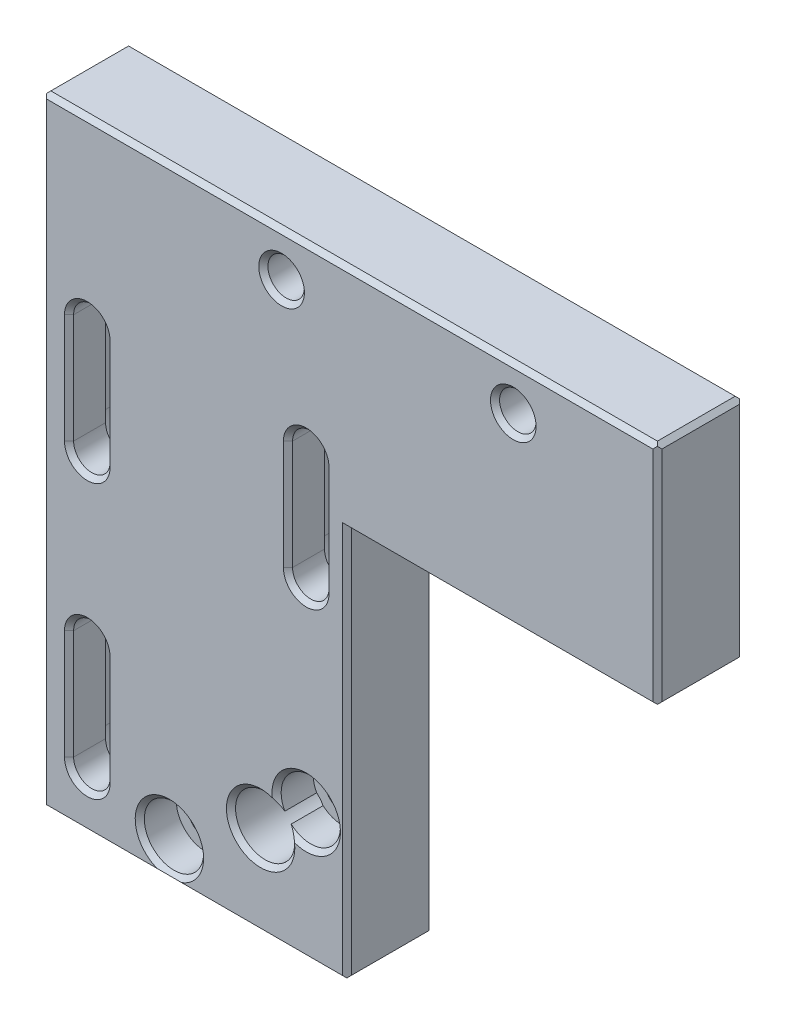
from build123d import *

# Parameters (mm, degrees)
SKETCH1_R           = 3.25
SKETCH1_R_2         = 2
BOSS_EXTRUDE1_DEPTH = 9.525
SKETCH1_4_R         = 2
SKETCH1_4_R_2       = 3.25
BOSS_EXTRUDE3_DEPTH = 5.525
CUT_EXTRUDE1_DEPTH  = 91.205186242
CUT_EXTRUDE2_DEPTH  = 5.525
CHAMFER1_SIZE       = 0.5
CHAMFER2_SIZE       = 0.5
CHAMFER3_SIZE       = 0.5
CHAMFER4_SIZE       = 0.5
SKETCH5_R           = 3.25
CUT_EXTRUDE3_DEPTH  = 5.525
CHAMFER5_SIZE       = 0.5


with BuildPart() as part:
    # Sketch1 → Boss-Extrude1 (new body)
    with BuildSketch(Plane.XY):
        Polygon((-9, 0), (0, 0), (24.45, 0), (24.45, 43), (58.5, 43), (58.5, 68), (0, 68), (-9, 68), align=None)
        with Locations(Location((5, 4, 0), (0, 0, 180))):
            Circle(SKETCH1_R, mode=Mode.SUBTRACT)
        with BuildLine():
            ThreePointArc((17.849215148, 11.563481065), (18.148209748, 10.807016347), (18.25, 10))
            ThreePointArc((18.25, 10), (12.037522087, 8.663502856), (17.150784852, 12.436518935))
            ThreePointArc((17.150784852, 12.436518935), (19.192983653, 17.148209748), (23.25, 14))
            ThreePointArc((23.25, 14), (21.336497144, 11.037522087), (17.849215148, 11.563481065))
        make_face(mode=Mode.SUBTRACT)
        with Locations(Location((17.3, 63.2375, 0), (0, 0, 180))):
            Circle(SKETCH1_R_2, mode=Mode.SUBTRACT)
        with Locations(Location((42.7, 63.2375, 0), (0, 0, 180))):
            Circle(SKETCH1_R_2, mode=Mode.SUBTRACT)
    extrude(amount=BOSS_EXTRUDE1_DEPTH)

    # Sketch1<4> → Boss-Extrude3 (add)
    # profile 1 of 2: a face of its own
    with BuildSketch(Plane.XY):
        with BuildLine():
            ThreePointArc((17.150784852, 12.436518935), (17.537823631, 12.030258905), (17.849215148, 11.563481065))
            ThreePointArc((17.849215148, 11.563481065), (22.537823631, 16.030258905), (17.150784852, 12.436518935))
        make_face()
        with Locations((20, 14)):
            Circle(SKETCH1_4_R, mode=Mode.SUBTRACT)
    # profile 2 of 2: a face of its own
    with BuildSketch(Plane.XY):
        with Locations(Location((5, 4, 0), (0, 0, 180))):
            Circle(SKETCH1_4_R_2)
        with Locations((5, 4)):
            Circle(SKETCH1_4_R, mode=Mode.SUBTRACT)
    extrude(amount=BOSS_EXTRUDE3_DEPTH)

    # Sketch3 → Cut-Extrude1 (cut, through all)
    with BuildSketch(Plane.XY.offset(9.525)):
        with BuildLine():
            Line((-2, 18), (-2, 6))
            ThreePointArc((-2, 6), (-4, 4), (-6, 6))
            Line((-6, 6), (-6, 18))
            ThreePointArc((-6, 18), (-4, 20), (-2, 18))
        make_face()
        with BuildLine():
            Line((-6, 48), (-6, 36))
            ThreePointArc((-6, 36), (-4, 34), (-2, 36))
            Line((-2, 36), (-2, 48))
            ThreePointArc((-2, 48), (-4, 50), (-6, 48))
        make_face()
        with BuildLine():
            Line((18, 48), (18, 36))
            ThreePointArc((18, 36), (20, 34), (22, 36))
            Line((22, 36), (22, 48))
            ThreePointArc((22, 48), (20, 50), (18, 48))
        make_face()
    extrude(amount=-CUT_EXTRUDE1_DEPTH, mode=Mode.SUBTRACT)

    # Sketch4 → Cut-Extrude2 (cut)
    with BuildSketch(Plane(origin=(0, 0, 0), x_dir=(-1, 0, 0), z_dir=(0, 0, -1))):
        with BuildLine():
            Line((-16.75, 36), (-16.75, 48))
            ThreePointArc((-16.75, 48), (-20, 51.25), (-23.25, 48))
            Line((-23.25, 48), (-23.25, 36))
            ThreePointArc((-23.25, 36), (-20, 32.75), (-16.75, 36))
        make_face()
        with BuildLine():
            Line((0.75, 48), (0.75, 36))
            ThreePointArc((0.75, 36), (4, 32.75), (7.25, 36))
            Line((7.25, 36), (7.25, 48))
            ThreePointArc((7.25, 48), (4, 51.25), (0.75, 48))
        make_face()
        with BuildLine():
            Line((7.25, 6), (7.25, 18))
            ThreePointArc((7.25, 18), (3.997663937, 21.24999916), (0.75, 17.99532787))
            Line((0.75, 17.99532787), (0.75, 5.99532787))
            ThreePointArc((0.75, 5.99532787), (4.002336066, 2.749997481), (7.25, 6))
        make_face()
    extrude(amount=-CUT_EXTRUDE2_DEPTH, mode=Mode.SUBTRACT)

    # Chamfer1
    chamfer1_edges = [part.edges().sort_by_distance(p)[0] for p in [
        (-9, 68, 4.7625),
    ]]
    chamfer(chamfer1_edges, length=CHAMFER1_SIZE)

    # Chamfer2
    chamfer2_edges = [part.edges().sort_by_distance(p)[0] for p in [
        (58.5, 68, 4.7625),
        (58.5, 43, 4.7625),
        (24.45, 0, 4.7625),
        (-9, 0, 4.7625),
    ]]
    chamfer(chamfer2_edges, length=CHAMFER2_SIZE)

    # Chamfer3
    # the kernel refuses this chamfer: 0.5 mm, written as the material it takes off along each edge
    with BuildSketch(Plane(origin=(59.285841494, 68, 0), x_dir=(0, -0.9996219169112968, -0.027495876610586483), z_dir=(-1, 0, 0)), Plane(origin=(-9.785841494, 68, 9.525), x_dir=(0, -0.9996219169112968, 0.02749587661058574), z_dir=(1, 0, 0))) as chamfer3_piece_1:
        Polygon((CHAMFER3_SIZE * 0.999621916911, CHAMFER3_SIZE * 0.0274958766106), (-CHAMFER3_SIZE * 0.0274958766106, CHAMFER3_SIZE * 0.999621916911), (0, 0), align=None)
    extrude(amount=69.071682988, mode=Mode.SUBTRACT)
    with BuildSketch(Plane(origin=(58.5, 42.214158506, 0), x_dir=(-0.9996219169112968, 0, -0.027495876610586483), z_dir=(0, 1, 0))) as chamfer3_piece_2:
        Polygon((CHAMFER3_SIZE * 0.999621916911, CHAMFER3_SIZE * 0.0274958766106), (-CHAMFER3_SIZE * 0.0274958766106, CHAMFER3_SIZE * 0.999621916911), (0, 0), align=None)
    extrude(amount=26.571682988, mode=Mode.SUBTRACT)
    with BuildSketch(Plane(origin=(24.45, 43, 0), x_dir=(0, 0.9996219169112968, -0.027495876610586483), z_dir=(1, 0, 0))) as chamfer3_piece_3:
        Polygon((CHAMFER3_SIZE * 0.999621916911, CHAMFER3_SIZE * 0.0274958766106), (-CHAMFER3_SIZE * 0.0274958766106, CHAMFER3_SIZE * 0.999621916911), (0, 0), align=None)
    extrude(amount=34.835841494, mode=Mode.SUBTRACT)
    with BuildSketch(Plane(origin=(24.45, -0.785841494, 0), x_dir=(-0.9996219169112968, 0, -0.027495876610586292), z_dir=(0, 1, 0))) as chamfer3_piece_4:
        Polygon((CHAMFER3_SIZE * 0.999621916911, CHAMFER3_SIZE * 0.0274958766106), (-CHAMFER3_SIZE * 0.0274958766106, CHAMFER3_SIZE * 0.999621916911), (0, 0), align=None)
    extrude(amount=43.785841494, mode=Mode.SUBTRACT)
    with BuildSketch(Plane(origin=(58.5, 42.214158506, 9.525), x_dir=(-0.9996219169112968, 0, 0.02749587661058574), z_dir=(0, 1, 0))) as chamfer3_piece_5:
        Polygon((CHAMFER3_SIZE * 0.999621916911, -CHAMFER3_SIZE * 0.0274958766106), (-CHAMFER3_SIZE * 0.0274958766106, -CHAMFER3_SIZE * 0.999621916911), (0, 0), align=None)
    extrude(amount=26.571682988, mode=Mode.SUBTRACT)
    with BuildSketch(Plane(origin=(24.45, 43, 9.525), x_dir=(0, 0.9996219169112968, 0.02749587661058574), z_dir=(1, 0, 0))) as chamfer3_piece_6:
        Polygon((CHAMFER3_SIZE * 0.999621916911, -CHAMFER3_SIZE * 0.0274958766106), (-CHAMFER3_SIZE * 0.0274958766106, -CHAMFER3_SIZE * 0.999621916911), (0, 0), align=None)
    extrude(amount=34.835841494, mode=Mode.SUBTRACT)
    with BuildSketch(Plane(origin=(24.45, -0.785841494, 9.525), x_dir=(-0.9996219169112968, 0, 0.02749587661058555), z_dir=(0, 1, 0))) as chamfer3_piece_7:
        Polygon((CHAMFER3_SIZE * 0.999621916911, -CHAMFER3_SIZE * 0.0274958766106), (-CHAMFER3_SIZE * 0.0274958766106, -CHAMFER3_SIZE * 0.999621916911), (0, 0), align=None)
    extrude(amount=43.785841494, mode=Mode.SUBTRACT)
    with BuildSketch(Plane(origin=(-9.785841494, 0, 0), x_dir=(0, 0.9996219169112968, -0.027495876610586334), z_dir=(1, 0, 0)), Plane(origin=(25.235841494, 0, 9.525), x_dir=(0, 0.9996219169112968, 0.02749587661058563), z_dir=(-1, 0, 0))) as chamfer3_piece_8:
        Polygon((CHAMFER3_SIZE * 0.999621916911, CHAMFER3_SIZE * 0.0274958766106), (-CHAMFER3_SIZE * 0.0274958766106, CHAMFER3_SIZE * 0.999621916911), (0, 0), align=None)
    extrude(amount=35.021682988, mode=Mode.SUBTRACT)
    with BuildSketch(Plane(origin=(-9, 68.785841494, 0), x_dir=(-0.02749587661058563, 0, 0.9996219169112968), z_dir=(0, -1, 0))) as chamfer3_piece_9:
        Polygon((CHAMFER3_SIZE * 0.999621916911, -CHAMFER3_SIZE * 0.0274958766106), (-CHAMFER3_SIZE * 0.0274958766106, -CHAMFER3_SIZE * 0.999621916911), (0, 0), align=None)
    extrude(amount=69.571682988, mode=Mode.SUBTRACT)
    with BuildSketch(Plane(origin=(-9, 68.785841494, 9.525), x_dir=(-0.027495876610585647, 0, -0.9996219169112968), z_dir=(0, -1, 0))) as chamfer3_piece_10:
        Polygon((CHAMFER3_SIZE * 0.999621916911, CHAMFER3_SIZE * 0.0274958766106), (-CHAMFER3_SIZE * 0.0274958766106, CHAMFER3_SIZE * 0.999621916911), (0, 0), align=None)
    extrude(amount=69.571682988, mode=Mode.SUBTRACT)
    with BuildSketch(Plane(origin=(24.45, -0.785841494, 0), x_dir=(-0.9996219169112968, 0, -0.027495876610586292), z_dir=(0, 1, 0))) as chamfer3_piece_11a_section:
        Polygon((CHAMFER3_SIZE * 0.999621916911, CHAMFER3_SIZE * 0.0274958766106), (-CHAMFER3_SIZE * 0.0274958766106, CHAMFER3_SIZE * 0.999621916911), (0, 0), align=None)
    chamfer3_piece_11a = extrude(amount=45.071682988, mode=Mode.PRIVATE)
    chamfer3_piece_11a = split(chamfer3_piece_11a, bisect_by=Plane(origin=(24.285103187, 43, 0.164896813), z_dir=(0, 1, 0)), keep=Keep.TOP, mode=Mode.PRIVATE)
    with BuildSketch(Plane(origin=(23.164158506, 43, 0), x_dir=(0, 0.9996219169112968, -0.027495876610586483), z_dir=(1, 0, 0))) as chamfer3_piece_11b_section:
        Polygon((CHAMFER3_SIZE * 0.999621916911, CHAMFER3_SIZE * 0.0274958766106), (-CHAMFER3_SIZE * 0.0274958766106, CHAMFER3_SIZE * 0.999621916911), (0, 0), align=None)
    chamfer3_piece_11b = extrude(amount=36.121682988, mode=Mode.PRIVATE)
    chamfer3_piece_11b = split(chamfer3_piece_11b, bisect_by=Plane(origin=(24.45, 43.164896813, 0.164896813), z_dir=(-1, 0, 0)), keep=Keep.TOP, mode=Mode.PRIVATE)
    chamfer3_piece_11 = chamfer3_piece_11a & chamfer3_piece_11b
    add(chamfer3_piece_11, mode=Mode.SUBTRACT)
    with BuildSketch(Plane(origin=(24.45, -0.785841494, 9.525), x_dir=(-0.9996219169112968, 0, 0.02749587661058555), z_dir=(0, 1, 0))) as chamfer3_piece_12a_section:
        Polygon((CHAMFER3_SIZE * 0.999621916911, -CHAMFER3_SIZE * 0.0274958766106), (-CHAMFER3_SIZE * 0.0274958766106, -CHAMFER3_SIZE * 0.999621916911), (0, 0), align=None)
    chamfer3_piece_12a = extrude(amount=45.071682988, mode=Mode.PRIVATE)
    chamfer3_piece_12a = split(chamfer3_piece_12a, bisect_by=Plane(origin=(24.285103187, 43, 9.360103187), z_dir=(0, 1, 0)), keep=Keep.TOP, mode=Mode.PRIVATE)
    with BuildSketch(Plane(origin=(23.164158506, 43, 9.525), x_dir=(0, 0.9996219169112968, 0.02749587661058574), z_dir=(1, 0, 0))) as chamfer3_piece_12b_section:
        Polygon((CHAMFER3_SIZE * 0.999621916911, -CHAMFER3_SIZE * 0.0274958766106), (-CHAMFER3_SIZE * 0.0274958766106, -CHAMFER3_SIZE * 0.999621916911), (0, 0), align=None)
    chamfer3_piece_12b = extrude(amount=36.121682988, mode=Mode.PRIVATE)
    chamfer3_piece_12b = split(chamfer3_piece_12b, bisect_by=Plane(origin=(24.45, 43.164896813, 9.360103187), z_dir=(-1, 0, 0)), keep=Keep.TOP, mode=Mode.PRIVATE)
    chamfer3_piece_12 = chamfer3_piece_12a & chamfer3_piece_12b
    add(chamfer3_piece_12, mode=Mode.SUBTRACT)

    # Chamfer4
    # the kernel refuses this chamfer: 0.5 mm, written as the material it takes off along each edge
    with BuildSketch(Plane(origin=(17.3, 63.2375, 9.525), x_dir=(-1, 0, 0), z_dir=(0, 1, 0))) as chamfer4_piece_1:
        Polygon((2 + CHAMFER4_SIZE, 0), (2, -CHAMFER4_SIZE), (2, 0), align=None)
    revolve(axis=Axis((17.3, 63.2375, 9.525), (0, 0, 1)), mode=Mode.SUBTRACT)
    with BuildSketch(Plane(origin=(20, 14, 9.525), x_dir=(-0.6228814791380578, -0.7823162167223593, 0), z_dir=(0.7823162167223593, -0.6228814791380578, 0))) as chamfer4_piece_2:
        Polygon((3.25 + CHAMFER4_SIZE, 0), (3.25, CHAMFER4_SIZE), (3.25, 0), align=None)
    revolve(axis=Axis((20, 14, 9.525), (0, 0, -1)), revolution_arc=231.473137965, mode=Mode.SUBTRACT)
    with BuildSketch(Plane(origin=(15, 10, 9.525), x_dir=(0.7789024218691897, 0.627145132490328, 0), z_dir=(0.627145132490328, -0.7789024218691897, 0))) as chamfer4_piece_3:
        Polygon((3.25 + CHAMFER4_SIZE, 0), (3.25, -CHAMFER4_SIZE), (3.25, 0), align=None)
    revolve(axis=Axis((15, 10, 9.525), (0, 0, 1)), revolution_arc=359.64, mode=Mode.SUBTRACT)
    with BuildSketch(Plane(origin=(5, 4, 9.525), x_dir=(-1, 0, 0), z_dir=(0, 1, 0))) as chamfer4_piece_4:
        Polygon((3.25 + CHAMFER4_SIZE, 0), (3.25, -CHAMFER4_SIZE), (3.25, 0), align=None)
    revolve(axis=Axis((5, 4, 9.525), (0, 0, 1)), mode=Mode.SUBTRACT)
    with BuildSketch(Plane(origin=(-4, 48, 9.525), x_dir=(1, 0, 0), z_dir=(0, -1, 0))) as chamfer4_piece_5:
        Polygon((2 + CHAMFER4_SIZE, 0), (2, -CHAMFER4_SIZE), (2, 0), align=None)
    revolve(axis=Axis((-4, 48, 9.525), (0, 0, 1)), revolution_arc=180, mode=Mode.SUBTRACT)
    with BuildSketch(Plane(origin=(-6, 48, 9.525), x_dir=(-0.9996219169112968, 0, 0.027495876610585647), z_dir=(0, -1, 0)), Plane(origin=(-2, 36, 9.525), x_dir=(0.9996219169112968, 0, 0.027495876610585706), z_dir=(0, 1, 0)), Plane(origin=(18, 48, 9.525), x_dir=(-0.9996219169112968, 0, 0.02749587661058555), z_dir=(0, -1, 0)), Plane(origin=(22, 36, 9.525), x_dir=(0.9996219169112968, 0, 0.02749587661058555), z_dir=(0, 1, 0))) as chamfer4_piece_6:
        Polygon((CHAMFER4_SIZE * 0.999621916911, CHAMFER4_SIZE * 0.0274958766106), (-CHAMFER4_SIZE * 0.0274958766106, CHAMFER4_SIZE * 0.999621916911), (0, 0), align=None)
    extrude(amount=12, mode=Mode.SUBTRACT)
    with BuildSketch(Plane(origin=(-4, 36, 9.525), x_dir=(-1, 0, 0), z_dir=(0, 1, 0))) as chamfer4_piece_7:
        Polygon((2 + CHAMFER4_SIZE, 0), (2, -CHAMFER4_SIZE), (2, 0), align=None)
    revolve(axis=Axis((-4, 36, 9.525), (0, 0, 1)), revolution_arc=180, mode=Mode.SUBTRACT)
    with BuildSketch(Plane(origin=(-4, 18, 9.525), x_dir=(-1, 0, 0), z_dir=(0, -1, 0))) as chamfer4_piece_8:
        Polygon((2 + CHAMFER4_SIZE, 0), (2, CHAMFER4_SIZE), (2, 0), align=None)
    revolve(axis=Axis((-4, 18, 9.525), (0, 0, -1)), revolution_arc=180, mode=Mode.SUBTRACT)
    with BuildSketch(Plane(origin=(-6, 6, 9.525), x_dir=(-0.9996219169112968, 0, 0.027495876610585647), z_dir=(0, 1, 0)), Plane(origin=(-2, 18, 9.525), x_dir=(0.9996219169112968, 0, 0.027495876610585657), z_dir=(0, -1, 0))) as chamfer4_piece_9:
        Polygon((CHAMFER4_SIZE * 0.999621916911, -CHAMFER4_SIZE * 0.0274958766106), (-CHAMFER4_SIZE * 0.0274958766106, -CHAMFER4_SIZE * 0.999621916911), (0, 0), align=None)
    extrude(amount=12, mode=Mode.SUBTRACT)
    with BuildSketch(Plane(origin=(-4, 6, 9.525), x_dir=(1, 0, 0), z_dir=(0, 1, 0))) as chamfer4_piece_10:
        Polygon((2 + CHAMFER4_SIZE, 0), (2, CHAMFER4_SIZE), (2, 0), align=None)
    revolve(axis=Axis((-4, 6, 9.525), (0, 0, -1)), revolution_arc=180, mode=Mode.SUBTRACT)
    with BuildSketch(Plane(origin=(20, 48, 9.525), x_dir=(1, 0, 0), z_dir=(0, -1, 0))) as chamfer4_piece_11:
        Polygon((2 + CHAMFER4_SIZE, 0), (2, -CHAMFER4_SIZE), (2, 0), align=None)
    revolve(axis=Axis((20, 48, 9.525), (0, 0, 1)), revolution_arc=180, mode=Mode.SUBTRACT)
    with BuildSketch(Plane(origin=(20, 36, 9.525), x_dir=(-1, 0, 0), z_dir=(0, 1, 0))) as chamfer4_piece_12:
        Polygon((2 + CHAMFER4_SIZE, 0), (2, -CHAMFER4_SIZE), (2, 0), align=None)
    revolve(axis=Axis((20, 36, 9.525), (0, 0, 1)), revolution_arc=180, mode=Mode.SUBTRACT)
    with BuildSketch(Plane(origin=(42.7, 63.2375, 9.525), x_dir=(-1, 0, 0), z_dir=(0, 1, 0))) as chamfer4_piece_13:
        Polygon((2 + CHAMFER4_SIZE, 0), (2, -CHAMFER4_SIZE), (2, 0), align=None)
    revolve(axis=Axis((42.7, 63.2375, 9.525), (0, 0, 1)), mode=Mode.SUBTRACT)
    with BuildSketch(Plane(origin=(20, 14, 9.525), x_dir=(1, 0, 0), z_dir=(0, 1, 0))) as chamfer4_piece_14:
        Polygon((3.25 + CHAMFER4_SIZE, 0), (3.25, CHAMFER4_SIZE), (3.25, 0), align=None)
    revolve(axis=Axis((20, 14, 9.525), (0, 0, -1)), revolution_arc=154.123896305, mode=Mode.SUBTRACT)

    # Sketch5 → Cut-Extrude3 (cut)
    with BuildSketch(Plane(origin=(0, 0, 0), x_dir=(-1, 0, 0), z_dir=(0, 0, -1))):
        with Locations((-42.7, 63.2375)):
            Circle(SKETCH5_R)
        with Locations((-17.3, 63.2375)):
            Circle(SKETCH5_R)
    extrude(amount=-CUT_EXTRUDE3_DEPTH, mode=Mode.SUBTRACT)

    # Chamfer5
    chamfer5_edges = [part.edges().sort_by_distance(p)[0] for p in [
        (20, 51.25, 0),
        (23.25, 42, 0),
        (20, 32.75, 0),
        (16.75, 42, 0),
        (-4, 51.25, 0),
        (-0.75, 42, 0),
        (-4, 32.75, 0),
        (-7.25, 42, 0),
        (-3.997662256, 21.249999159, 0),
        (-0.75, 11.99532787, 0),
        (-4.002334388, 2.74999748, 0),
        (-7.25, 12, 0),
        (12.849215148, 7.563481065, 0),
        (20.55, 63.2375, 0),
        (45.95, 63.2375, 0),
        (18, 14, 0),
        (3, 4, 0),
    ]]
    chamfer(chamfer5_edges, length=CHAMFER5_SIZE)


solid = part.part
